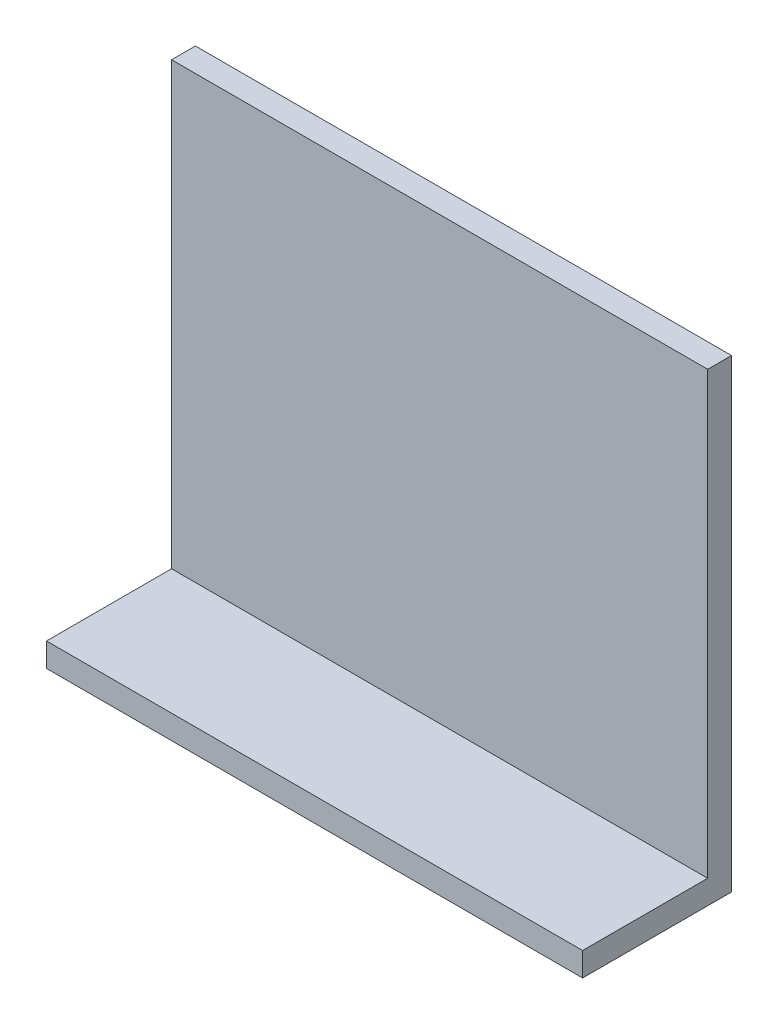
from build123d import *

# Parameters (mm, degrees)
SKETCH1_W           = 45
SKETCH1_H           = 12.5
BOSS_EXTRUDE1_DEPTH = 2
SKETCH2_W           = 45
SKETCH2_H           = 37
BOSS_EXTRUDE2_DEPTH = 2


with BuildPart() as part:
    # Sketch1 → Boss-Extrude1 (new body)
    with BuildSketch(Plane(origin=(0, 0, 0), x_dir=(1, 0, 0), z_dir=(0, 1, 0))):
        with Locations((22.5, 6.25)):
            Rectangle(SKETCH1_W, SKETCH1_H)
    extrude(amount=BOSS_EXTRUDE1_DEPTH)

    # Sketch2 → Boss-Extrude2 (add)
    with BuildSketch(Plane(origin=(0, 0, -12.5), x_dir=(-1, 0, 0), z_dir=(0, 0, -1))):
        with Locations((-22.5, 20.5)):
            Rectangle(SKETCH2_W, SKETCH2_H)
    extrude(amount=-BOSS_EXTRUDE2_DEPTH)


solid = part.part
